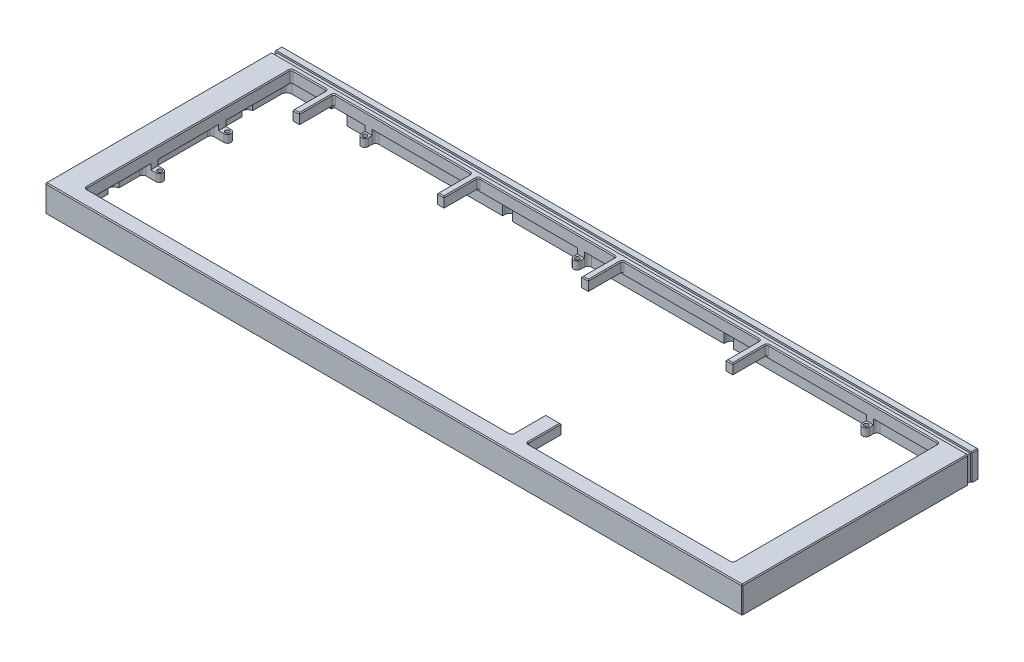
from build123d import *

# Parameters (mm, degrees)
SKETCH1_W                 = 390.74
SKETCH1_H                 = 132.7
SKETCH1_W_2               = 362.9
SKETCH1_H_2               = 115.3
MAIN_BODY_DEPTH           = 14.8
SKETCH2_W                 = 386.74
SKETCH2_H                 = 128.7
ALIGNMENT_GUIDE_DEPTH     = 1
SKETCH3_W                 = 8.7
SKETCH3_H                 = 19.1
SKETCH3_W_2               = 3.8
BLOCKERS_DEPTH            = 5.5
FILLET5_R                 = 1
SKETCH4_W                 = 371.8
SKETCH4_H                 = 119.1
PCB_CUTOUT_DEPTH          = 7.3
FILLET4_R                 = 3
PLATETABS_DEPTH           = 7.3
USB_CUTOUT_REACH          = 414.924
SKETCH9_W                 = 12
SKETCH9_H                 = 3.2
SKETCH11_W                = 15
SKETCH11_H                = 7.3
PCB_CLEARANCE_DEPTH       = 3.9
FILLET7_R                 = 2.5
CHAMFER1_SIZE             = 0.5
CHAMFER2_SIZE             = 0.1
SKETCH27_W                = 390.74
SKETCH27_H                = 2.5
CUT_EXTRUDE11_DEPTH       = 1
SKETCH28_W                = 1
SKETCH28_H                = 2.5
CUT_EXTRUDE12_DEPTH       = 413.889183196
M2X0_4_TAPPED_HOLE1_D     = 1.6
M2X0_4_TAPPED_HOLE1_DEPTH = 4
M2X0_4_TAPPED_HOLE1_TIP   = 0.480688495
FILLET8_R                 = 0.1
SKETCH32_R                = 2
SKETCH32_W                = 4
SKETCH32_H                = 4
SKETCH32_W_2              = 7.33
SKETCH32_H_2              = 4.8
BOSS_EXTRUDE1_DEPTH       = 4.3
SKETCH33_W                = 4.45
SKETCH33_H                = 4
SKETCH33_W_2              = 4
SKETCH33_H_2              = 1.9
BOSS_EXTRUDE2_DEPTH       = 3
FILLET9_R                 = 1.9
M2_CLEARANCE_HOLE1_D      = 2.4


with BuildPart() as part:
    # Sketch1 → Main Body (new body)
    with BuildSketch(Plane(origin=(0, 0, 0), x_dir=(1, 0, 0), z_dir=(0, 1, 0))):
        with Locations((195.37, 66.35)):
            Rectangle(SKETCH1_W, SKETCH1_H)
        with Locations((195.37, 66.35)):
            Rectangle(SKETCH1_W_2, SKETCH1_H_2, mode=Mode.SUBTRACT)
    extrude(amount=MAIN_BODY_DEPTH)

    # Sketch2 → Alignment Guide (cut)
    with BuildSketch(Plane.XZ):
        with Locations((195.37, -66.35)):
            Rectangle(SKETCH2_W, SKETCH2_H)
    extrude(amount=-ALIGNMENT_GUIDE_DEPTH, mode=Mode.SUBTRACT)

    # Sketch3 → Blockers (add)
    with BuildSketch(Plane(origin=(0, 14.8, 0), x_dir=(1, 0, 0), z_dir=(0, 1, 0))):
        with Locations((257.17, 18.25)):
            Rectangle(SKETCH3_W, SKETCH3_H)
        with Locations((35.82, 114.45)):
            Rectangle(SKETCH3_W_2, SKETCH3_H)
        with Locations((116.82, 114.45)):
            Rectangle(SKETCH3_W_2, SKETCH3_H)
        with Locations((197.72, 114.45)):
            Rectangle(SKETCH3_W_2, SKETCH3_H)
        with Locations((278.72, 114.45)):
            Rectangle(SKETCH3_W_2, SKETCH3_H)
    extrude(amount=-BLOCKERS_DEPTH)

    # Fillet5
    fillet5_edges = [part.edges().sort_by_distance(p)[0] for p in [
        (13.92, 7.9, -124),
        (13.92, 7.9, -8.7),
        (376.82, 7.9, -8.7),
        (376.82, 7.9, -124),
        (252.82, 12.05, -8.7),
        (261.52, 12.05, -8.7),
        (33.92, 12.05, -124),
        (37.72, 12.05, -124),
        (114.92, 12.05, -124),
        (118.72, 12.05, -124),
        (195.82, 12.05, -124),
        (199.62, 12.05, -124),
        (276.82, 12.05, -124),
        (280.62, 12.05, -124),
    ]]
    fillet(fillet5_edges, radius=FILLET5_R)

    # Sketch4 → PCB Cutout (cut)
    with BuildSketch(Plane.XZ.offset(-1)):
        with Locations((195.37, -66.35)):
            Rectangle(SKETCH4_W, SKETCH4_H)
    extrude(amount=-PCB_CUTOUT_DEPTH, mode=Mode.SUBTRACT)

    # Fillet4
    fillet4_edges = [part.edges().sort_by_distance(p)[0] for p in [
        (381.27, 4.65, -6.8),
        (381.27, 4.65, -125.9),
        (9.47, 4.65, -125.9),
        (9.47, 4.65, -6.8),
        (2, 0.5, -2),
        (388.74, 0.5, -2),
        (388.74, 0.5, -130.7),
        (2, 0.5, -130.7),
    ]]
    fillet(fillet4_edges, radius=FILLET4_R)

    # Sketch6 → PlateTabs (cut)
    with BuildSketch(Plane.XZ.offset(-1)):
        with BuildLine():
            ThreePointArc((381.27, -106.843325909), (383.26089023, -105.899390153), (384.07, -103.85))
            ThreePointArc((384.07, -103.85), (383.26089023, -101.800609847), (381.27, -100.856674091))
            Line((381.27, -100.856674091), (381.27, -106.843325909))
        make_face()
        with BuildLine():
            Line((381.27, -106.843325909), (381.27, -100.856674091))
            ThreePointArc((381.27, -100.856674091), (378.07, -103.85), (381.27, -106.843325909))
        make_face()
        with BuildLine():
            ThreePointArc((381.27, -25.856674091), (378.07, -28.85), (381.27, -31.843325909))
            Line((381.27, -31.843325909), (381.27, -25.856674091))
        make_face()
        with BuildLine():
            Line((381.27, -25.856674091), (381.27, -31.843325909))
            ThreePointArc((381.27, -31.843325909), (383.26089023, -30.899390153), (384.07, -28.85))
            ThreePointArc((384.07, -28.85), (383.26089023, -26.800609847), (381.27, -25.856674091))
        make_face()
        with BuildLine():
            Line((254.62, -6.8), (255.482541391, -6.8))
            ThreePointArc((255.482541391, -6.8), (254.844825632, -5.889033706), (254.62, -4.8))
            Line((254.62, -4.8), (254.62, -6.8))
        make_face()
        with BuildLine():
            Line((255.482541391, -6.8), (259.257458609, -6.8))
            ThreePointArc((259.257458609, -6.8), (259.895174368, -5.889033706), (260.12, -4.8))
            Line((260.12, -4.8), (254.62, -4.8))
            ThreePointArc((254.62, -4.8), (254.844825632, -5.889033706), (255.482541391, -6.8))
        make_face()
        with BuildLine():
            Line((259.257458609, -6.8), (260.12, -6.8))
            Line((260.12, -6.8), (260.12, -4.8))
            ThreePointArc((260.12, -4.8), (259.895174368, -5.889033706), (259.257458609, -6.8))
        make_face()
        with BuildLine():
            Line((254.62, -4.8), (260.12, -4.8))
            ThreePointArc((260.12, -4.8), (257.37, -2.05), (254.62, -4.8))
        make_face()
        with BuildLine():
            Line((260.12, -127.1), (254.62, -127.1))
            ThreePointArc((254.62, -127.1), (257.37, -129.85), (260.12, -127.1))
        make_face()
        with BuildLine():
            ThreePointArc((254.895631394, -125.9), (254.689793509, -126.484375791), (254.62, -127.1))
            Line((254.62, -127.1), (260.12, -127.1))
            ThreePointArc((260.12, -127.1), (260.050206491, -126.484375791), (259.844368606, -125.9))
            Line((259.844368606, -125.9), (254.895631394, -125.9))
        make_face()
        with BuildLine():
            Line((254.62, -125.9), (254.62, -127.1))
            ThreePointArc((254.62, -127.1), (254.689793509, -126.484375791), (254.895631394, -125.9))
            Line((254.895631394, -125.9), (254.62, -125.9))
        make_face()
        with BuildLine():
            ThreePointArc((130.62, -127.1), (133.37, -129.85), (136.12, -127.1))
            Line((136.12, -127.1), (130.62, -127.1))
        make_face()
        with BuildLine():
            ThreePointArc((136.12, -127.1), (136.050206491, -126.484375791), (135.844368606, -125.9))
            Line((135.844368606, -125.9), (130.895631394, -125.9))
            ThreePointArc((130.895631394, -125.9), (130.689793509, -126.484375791), (130.62, -127.1))
            Line((130.62, -127.1), (136.12, -127.1))
        make_face()
        with BuildLine():
            ThreePointArc((12.67, -103.85), (11.719390153, -101.65910977), (9.47, -100.856674091))
            Line((9.47, -100.856674091), (9.47, -106.843325909))
            ThreePointArc((9.47, -106.843325909), (11.719390153, -106.04089023), (12.67, -103.85))
        make_face()
        with BuildLine():
            Line((9.47, -106.843325909), (9.47, -100.856674091))
            ThreePointArc((9.47, -100.856674091), (6.67, -103.85), (9.47, -106.843325909))
        make_face()
        with BuildLine():
            ThreePointArc((9.47, -31.843325909), (11.719390153, -31.04089023), (12.67, -28.85))
            ThreePointArc((12.67, -28.85), (11.719390153, -26.65910977), (9.47, -25.856674091))
            Line((9.47, -25.856674091), (9.47, -31.843325909))
        make_face()
        with BuildLine():
            Line((9.47, -31.843325909), (9.47, -25.856674091))
            ThreePointArc((9.47, -25.856674091), (6.67, -28.85), (9.47, -31.843325909))
        make_face()
        with BuildLine():
            Line((130.62, -4.8), (136.12, -4.8))
            ThreePointArc((136.12, -4.8), (133.37, -2.05), (130.62, -4.8))
        make_face()
        with BuildLine():
            ThreePointArc((135.257458609, -6.8), (135.895174368, -5.889033706), (136.12, -4.8))
            Line((136.12, -4.8), (130.62, -4.8))
            ThreePointArc((130.62, -4.8), (130.844825632, -5.889033706), (131.482541391, -6.8))
            Line((131.482541391, -6.8), (135.257458609, -6.8))
        make_face()
        with BuildLine():
            ThreePointArc((259.844368606, -125.9), (260.050206491, -126.484375791), (260.12, -127.1))
            Line((260.12, -127.1), (260.12, -125.9))
            Line((260.12, -125.9), (259.844368606, -125.9))
        make_face()
        with BuildLine():
            ThreePointArc((131.482541391, -6.8), (130.844825632, -5.889033706), (130.62, -4.8))
            Line((130.62, -4.8), (130.62, -6.8))
            Line((130.62, -6.8), (131.482541391, -6.8))
        make_face()
        with BuildLine():
            Line((135.257458609, -6.8), (136.12, -6.8))
            Line((136.12, -6.8), (136.12, -4.8))
            ThreePointArc((136.12, -4.8), (135.895174368, -5.889033706), (135.257458609, -6.8))
        make_face()
        with BuildLine():
            Line((136.12, -127.1), (136.12, -125.9))
            Line((136.12, -125.9), (135.844368606, -125.9))
            ThreePointArc((135.844368606, -125.9), (136.050206491, -126.484375791), (136.12, -127.1))
        make_face()
        with BuildLine():
            ThreePointArc((130.62, -127.1), (130.689793509, -126.484375791), (130.895631394, -125.9))
            Line((130.895631394, -125.9), (130.62, -125.9))
            Line((130.62, -125.9), (130.62, -127.1))
        make_face()
    extrude(amount=-PLATETABS_DEPTH, mode=Mode.SUBTRACT)

    # USB Cutout: up to this face of the body (flat: up to its plane)
    usb_cutout_end = Plane(part.part.faces().sort_by_distance((195.37, 8.660958529, -124))[0])
    # Sketch9 → USB Cutout (cut, up to the picked face)
    with BuildSketch(Plane(origin=(0, 0, -132.7), x_dir=(-1, 0, 0), z_dir=(0, 0, -1)), mode=Mode.PRIVATE) as usb_cutout_sk1:
        with Locations((-35.8, 1.6)):
            Rectangle(SKETCH9_W, SKETCH9_H)
    usb_cutout_tool1 = split(extrude(usb_cutout_sk1.sketch, amount=-USB_CUTOUT_REACH, mode=Mode.PRIVATE), bisect_by=usb_cutout_end, keep=Keep.BOTH, mode=Mode.PRIVATE)
    add(usb_cutout_tool1.solids().sort_by(Axis((35.8, 1.6, -132.7), (0, 0, 1)))[0], mode=Mode.SUBTRACT)

    # Sketch11 → PCB Clearance (cut)
    with BuildSketch(Plane.XY.offset(-125.9)):
        with Locations((35.8, 4.65)):
            Rectangle(SKETCH11_W, SKETCH11_H)
    extrude(amount=-PCB_CLEARANCE_DEPTH, mode=Mode.SUBTRACT)

    # Fillet7
    fillet7_edges = [part.edges().sort_by_distance(p)[0] for p in [
        (28.3, 4.65, -129.8),
        (43.3, 4.65, -129.8),
    ]]
    fillet(fillet7_edges, radius=FILLET7_R)

    # Chamfer1
    chamfer1_edges = [part.edges().sort_by_distance(p)[0] for p in [
        (238.22, 14.8, -124),
        (157.27, 14.8, -124),
        (76.32, 14.8, -124),
        (23.92, 14.8, -124),
        (328.72, 14.8, -124),
        (276.82, 14.8, -113.95),
        (195.82, 14.8, -113.95),
        (114.92, 14.8, -113.95),
        (33.92, 14.8, -113.95),
        (390.74, 14.8, -66.35),
        (13.92, 14.8, -66.35),
        (319.17, 14.8, -8.7),
        (133.37, 14.8, -8.7),
        (261.52, 14.8, -18.75),
        (376.82, 14.8, -66.35),
        (280.912893219, 14.8, -123.707106781),
        (276.527106781, 14.8, -123.707106781),
        (195.527106781, 14.8, -123.707106781),
        (199.912893219, 14.8, -123.707106781),
        (119.012893219, 14.8, -123.707106781),
        (114.627106781, 14.8, -123.707106781),
        (33.627106781, 14.8, -123.707106781),
        (38.012893219, 14.8, -123.707106781),
        (14.212893219, 14.8, -123.707106781),
        (14.212893219, 14.8, -8.992893219),
        (252.527106781, 14.8, -8.992893219),
        (261.812893219, 14.8, -8.992893219),
        (376.527106781, 14.8, -8.992893219),
        (376.527106781, 14.8, -123.707106781),
        (195.37, 14.8, -132.7),
        (0, 14.8, -66.35),
        (252.82, 14.8, -18.75),
        (257.17, 14.8, -27.8),
        (35.82, 14.8, -104.9),
        (37.72, 14.8, -113.95),
        (116.82, 14.8, -104.9),
        (118.72, 14.8, -113.95),
        (0, 7.4, -132.7),
        (390.74, 7.4, -132.7),
        (390.74, 7.4, 0),
        (0, 7.4, 0),
        (197.72, 14.8, -104.9),
        (199.62, 14.8, -113.95),
        (195.37, 14.8, 0),
        (278.72, 14.8, -104.9),
        (280.62, 14.8, -113.95),
    ]]
    chamfer(chamfer1_edges, length=CHAMFER1_SIZE)

    # Chamfer2
    chamfer2_edges = [part.edges().sort_by_distance(p)[0] for p in [
        (15.15, 0, -132.7),
        (216.02, 0, -132.7),
        (390.74, 0, -66.35),
        (195.37, 0, 0),
        (0, 0, -66.35),
    ]]
    chamfer(chamfer2_edges, length=CHAMFER2_SIZE)

    # Sketch27 → Cut-Extrude11 (cut)
    with BuildSketch(Plane(origin=(0, 14.8, 0), x_dir=(1, 0, 0), z_dir=(0, 1, 0))):
        with Locations((195.37, 127.7)):
            Rectangle(SKETCH27_W, SKETCH27_H)
    extrude(amount=-CUT_EXTRUDE11_DEPTH, mode=Mode.SUBTRACT)

    # Sketch28 → Cut-Extrude12 (cut, through all)
    with BuildSketch(Plane(origin=(0, 13.8, 0), x_dir=(1, 0, 0), z_dir=(0, 1, 0))):
        with Locations((0.5, 127.7)):
            Rectangle(SKETCH28_W, SKETCH28_H)
        with Locations((390.24, 127.7)):
            Rectangle(SKETCH28_W, SKETCH28_H)
    extrude(amount=-CUT_EXTRUDE12_DEPTH, mode=Mode.SUBTRACT)

    # M2x0.4 Tapped Hole1
    with Locations(Plane(origin=(381.42, 8.3, -103.85), x_dir=(0, 0, -1), z_dir=(0, -1, 0))):
        with Locations((0, 0), (-75, 0), (-99, -124.05), (-99, -248.05), (-75, -372.1), (0, -372.1), (23.25, -248.05), (23.25, -124.05)):
            Hole(M2X0_4_TAPPED_HOLE1_D / 2, depth=M2X0_4_TAPPED_HOLE1_DEPTH)
            with Locations((0, 0, -(M2X0_4_TAPPED_HOLE1_DEPTH + M2X0_4_TAPPED_HOLE1_TIP / 2))):  # 118° drill point
                Cone(0, M2X0_4_TAPPED_HOLE1_D / 2, M2X0_4_TAPPED_HOLE1_TIP, mode=Mode.SUBTRACT)

    # Fillet8
    fillet8_edges = [part.edges().sort_by_distance(p)[0] for p in [
        (213.77, 0, -130.7),
        (2, 0, -66.35),
        (195.37, 0, -2),
        (388.74, 0, -66.35),
        (2.878679656, 0, -129.821320344),
        (2.878679656, 0, -2.878679656),
        (387.861320344, 0, -2.878679656),
        (387.861320344, 0, -129.821320344),
        (17.4, 0, -130.7),
    ]]
    fillet(fillet8_edges, radius=FILLET8_R)

    # Sketch32 → Boss-Extrude1 (add)
    with BuildSketch(Plane.XZ.offset(-1)):
        with Locations((338.3, -121.9)):
            Circle(SKETCH32_R)
        with Locations((176.4, -121.9)):
            Circle(SKETCH32_R)
        with Locations((57.3, -121.9)):
            Circle(SKETCH32_R)
        with Locations((16.8, -85.4)):
            Circle(SKETCH32_R)
        with Locations((16.8, -47.3)):
            Circle(SKETCH32_R)
        with Locations((85.9, -11.6)):
            Circle(SKETCH32_R)
        with Locations((156.5, -11.6)):
            Circle(SKETCH32_R)
        with Locations((300.2, -11.6)):
            Circle(SKETCH32_R)
        with Locations((373.94, -47.3)):
            Circle(SKETCH32_R)
        with Locations((373.94, -85.4)):
            Circle(SKETCH32_R)
        with Locations((338.3, -123.9)):
            Rectangle(SKETCH32_W, SKETCH32_H)
        with Locations((176.4, -123.9)):
            Rectangle(SKETCH32_W, SKETCH32_H)
        with Locations((57.3, -123.9)):
            Rectangle(SKETCH32_W, SKETCH32_H)
        with Locations((13.135, -85.4)):
            Rectangle(SKETCH32_W_2, SKETCH32_H)
        with Locations((13.135, -47.3)):
            Rectangle(SKETCH32_W_2, SKETCH32_H)
        with Locations((85.9, -9.2)):
            Rectangle(SKETCH32_W, SKETCH32_H_2)
        with Locations((156.5, -9.2)):
            Rectangle(SKETCH32_W, SKETCH32_H_2)
        with Locations((300.2, -9.2)):
            Rectangle(SKETCH32_W, SKETCH32_H_2)
        with Locations((377.605, -47.3)):
            Rectangle(SKETCH32_W_2, SKETCH32_H)
        with Locations((377.605, -85.4)):
            Rectangle(SKETCH32_W_2, SKETCH32_H)
    extrude(amount=-BOSS_EXTRUDE1_DEPTH)

    # Sketch33 → Boss-Extrude2 (add)
    with BuildSketch(Plane.XZ.offset(-8.3)):
        with Locations((379.045, -85.4)):
            Rectangle(SKETCH33_W, SKETCH33_H)
        with Locations((379.045, -47.3)):
            Rectangle(SKETCH33_W, SKETCH33_H)
        with Locations((300.2, -7.75)):
            Rectangle(SKETCH33_W_2, SKETCH33_H_2)
        with Locations((156.5, -7.75)):
            Rectangle(SKETCH33_W_2, SKETCH33_H_2)
        with Locations((85.9, -7.75)):
            Rectangle(SKETCH33_W_2, SKETCH33_H_2)
        with Locations((11.695, -47.3)):
            Rectangle(SKETCH33_W, SKETCH33_H)
        with Locations((11.695, -85.4)):
            Rectangle(SKETCH33_W, SKETCH33_H)
        with Locations((57.3, -124.95)):
            Rectangle(SKETCH33_W_2, SKETCH33_H_2)
        with Locations((176.4, -124.95)):
            Rectangle(SKETCH33_W_2, SKETCH33_H_2)
        with Locations((338.3, -124.95)):
            Rectangle(SKETCH33_W_2, SKETCH33_H_2)
    extrude(amount=BOSS_EXTRUDE2_DEPTH)

    # Fillet9
    fillet9_edges = [part.edges().sort_by_distance(p)[0] for p in [
        (340.3, 4.65, -125.9),
        (336.3, 4.65, -125.9),
        (174.4, 4.65, -125.9),
        (178.4, 4.65, -125.9),
        (59.3, 4.65, -125.9),
        (55.3, 4.65, -125.9),
        (9.47, 4.65, -87.4),
        (9.47, 4.65, -83.4),
        (9.47, 4.65, -45.3),
        (9.47, 4.65, -49.3),
        (87.9, 4.65, -6.8),
        (83.9, 4.65, -6.8),
        (154.5, 4.65, -6.8),
        (158.5, 4.65, -6.8),
        (302.2, 4.65, -6.8),
        (298.2, 4.65, -6.8),
        (381.27, 4.65, -45.3),
        (381.27, 4.65, -49.3),
        (381.27, 4.65, -87.4),
    ]]
    fillet(fillet9_edges, radius=FILLET9_R - 0.0001)  # a hair under: the kernel refuses the full size

    # M2 Clearance Hole1 (through all)
    with Locations(Plane(origin=(57.3, 5.3, -121.9), x_dir=(0, 0, 1), z_dir=(0, 1, 0))):
        with Locations((0, 0), (36.5, -40.5), (74.6, -40.5), (110.3, 28.6), (110.3, 99.2), (110.3, 242.9), (74.6, 316.64), (36.5, 316.64), (0, 281), (0, 119.1)):
            Hole(M2_CLEARANCE_HOLE1_D / 2)


solid = part.part
